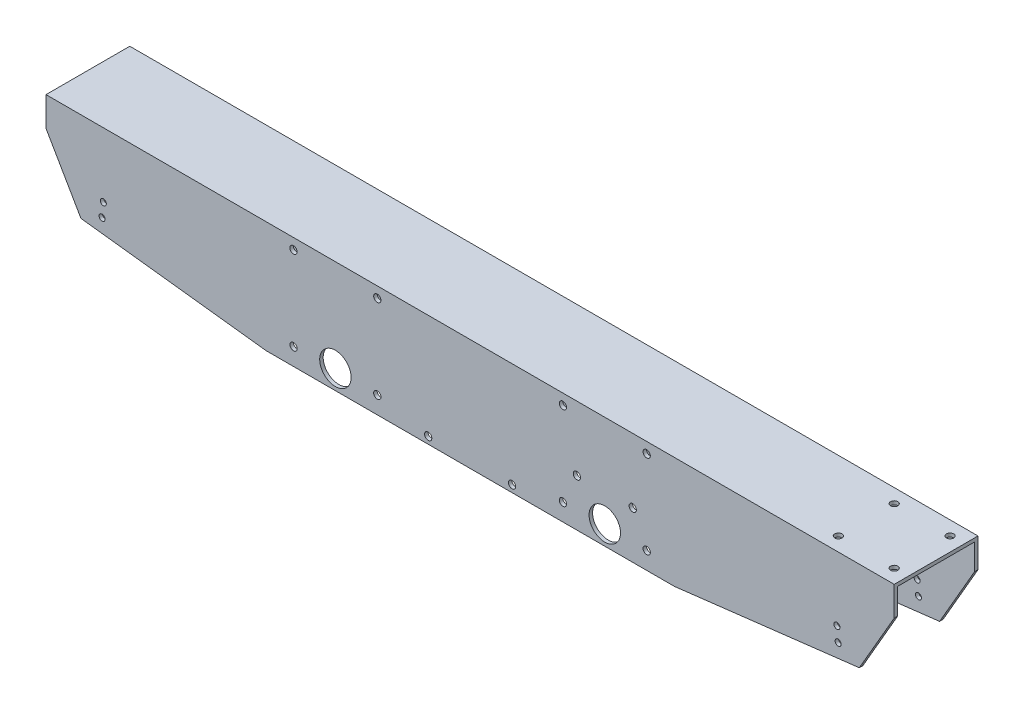
from build123d import *

# Parameters (mm, degrees)
BOSS_EXTRUDE1_DEPTH                     = 385.705756272
SKETCH2_R                               = 2.749999961
SKETCH2_R_2                             = 2.75
SKETCH2_R_3                             = 3.302
SKETCH2_R_4                             = 14.2875
AXLES_DEPTH                             = 141.732
FLANIGAN_MOUNTING_HOLES_R               = 3.3
FLANIGAN_MOUNTING_HOLES_EXTRUSION_DEPTH = 397.429073633
BEVELED_ENDS_DEPTH                      = 101.6
SKETCH32_R                              = 3.3
BELT_SHIELD_HOLES_DEPTH                 = 397.429073633
SKETCH37_R                              = 3.3
CUT_EXTRUDE26_DEPTH                     = 401.678300412


with BuildPart() as part:
    # Sketch1 → Boss-Extrude1 (new, symmetric)
    with BuildSketch(Plane(origin=(0, 0, 0), x_dir=(0, 0, -1), z_dir=(1, 0, 0))):
        Polygon((-38.1, 50.8), (38.1, 50.8), (38.1, -50.8), (34.925, -50.8), (34.925, 47.625), (-34.925, 47.625), (-34.925, -50.8), (-38.1, -50.8), align=None)
    extrude(amount=BOSS_EXTRUDE1_DEPTH, both=True)

    # Sketch2 → Axles (cut)
    with BuildSketch(Plane.XY.offset(38.1)):
        with Locations((-333.577237048, -7.874)):
            Circle(SKETCH2_R)
        with Locations((334.720333616, -20.574)):
            Circle(SKETCH2_R_2)
        with Locations((333.577237048, -7.874)):
            Circle(SKETCH2_R)
        with Locations((160.6, 41.08)):
            Circle(SKETCH2_R_3)
        with Locations((-160.6, -35.12)):
            Circle(SKETCH2_R_3)
        with Locations((-160.6, 41.08)):
            Circle(SKETCH2_R_3)
        with Locations((-122.5, -33.274)):
            Circle(SKETCH2_R_4)
        with Locations((-334.720333616, -20.574)):
            Circle(SKETCH2_R_2)
        with Locations((-84.4, 41.08)):
            Circle(SKETCH2_R_3)
        with Locations((-84.4, -35.12)):
            Circle(SKETCH2_R_3)
        with Locations((84.4, 41.08)):
            Circle(SKETCH2_R_3)
        with Locations((84.4, -35.12)):
            Circle(SKETCH2_R_3)
        with Locations((160.6, -35.12)):
            Circle(SKETCH2_R_3)
        with Locations((122.5, -33.274)):
            Circle(SKETCH2_R_4)
    extrude(amount=-AXLES_DEPTH, mode=Mode.SUBTRACT)

    # Flanigan mounting holes → Flanigan mounting holes extrusion (cut, through all)
    with BuildSketch(Plane.XY.offset(38.1)):
        with Locations((97.1, -7.87)):
            Circle(FLANIGAN_MOUNTING_HOLES_R)
        with Locations((147.9, -7.87)):
            Circle(FLANIGAN_MOUNTING_HOLES_R)
    extrude(amount=-FLANIGAN_MOUNTING_HOLES_EXTRUSION_DEPTH, mode=Mode.SUBTRACT)

    # Sketch16 → Beveled ends (cut)
    with BuildSketch(Plane.XY.offset(38.1)):
        Polygon((-353.951491467, -30.8), (-185.705756272, -50.8), (-385.705756272, -50.8), (-385.705756272, 24.2), align=None)
        Polygon((385.705756272, -50.8), (185.705756272, -50.8), (353.951491467, -30.8), (385.705756272, 24.2), align=None)
    extrude(amount=-BEVELED_ENDS_DEPTH, mode=Mode.SUBTRACT)

    # Sketch32 → Belt shield holes (cut, through all)
    with BuildSketch(Plane(origin=(0, 0, -38.1), x_dir=(-1, 0, 0), z_dir=(0, 0, -1))):
        with Locations((-38.1, -44.45)):
            Circle(SKETCH32_R)
        with Locations((38.1, -44.45)):
            Circle(SKETCH32_R)
    extrude(amount=-BELT_SHIELD_HOLES_DEPTH, mode=Mode.SUBTRACT)

    # Sketch37 → Cut-Extrude26 (cut, through all)
    with BuildSketch(Plane(origin=(0, 50.8, 0), x_dir=(1, 0, 0), z_dir=(0, 1, 0))):
        with Locations((373.005756272, 25.4)):
            Circle(SKETCH37_R)
        with Locations((373.005756272, -25.4)):
            Circle(SKETCH37_R)
        with Locations((322.205756272, 25.4)):
            Circle(SKETCH37_R)
        with Locations((322.205756272, -25.4)):
            Circle(SKETCH37_R)
    extrude(amount=-CUT_EXTRUDE26_DEPTH, mode=Mode.SUBTRACT)


solid = part.part
